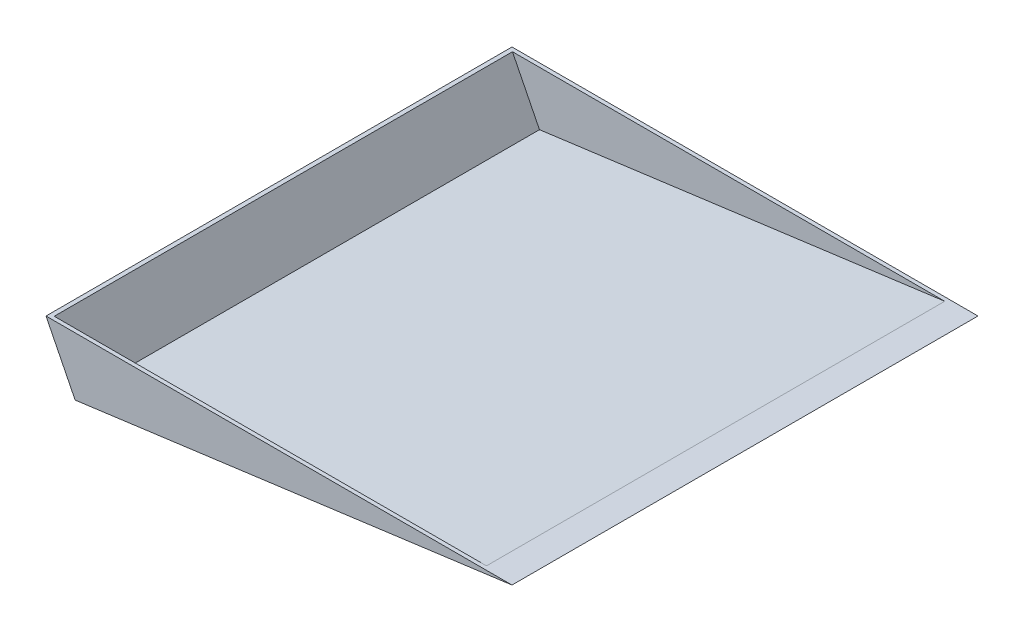
from build123d import *

# Parameters (mm, degrees)
BOSS_EXTRUDE1_DEPTH = 609.6
SHELL1_T            = -5.08


with BuildPart() as part:
    # 3DSketch1 → Boss-Extrude1 (new body)
    with BuildSketch(Plane(origin=(574.750801769, 1402.417106037, 1756.25455637), x_dir=(1, 0, 0), z_dir=(0, 0, -1))):
        Polygon((0, 0), (38.1, 76.2), (609.6, 0), align=None)
    extrude(amount=BOSS_EXTRUDE1_DEPTH)

    # Shell1
    shell1_openings = [part.faces().sort_by_distance(p)[0] for p in [
        (879.550801769, 1402.417106037, 1451.45455637),
    ]]
    offset(amount=SHELL1_T, openings=shell1_openings, kind=Kind.INTERSECTION)


solid = part.part
